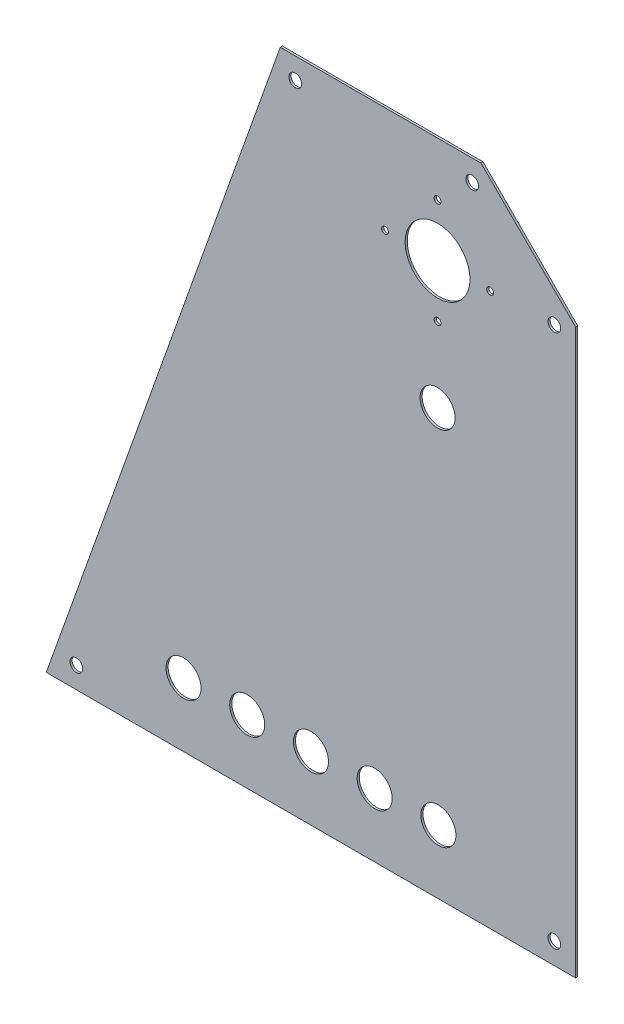
from build123d import *

# Parameters (mm, degrees)
SKETCH1_W           = 310
SKETCH1_H           = 250
BOSS_EXTRUDE1_DEPTH = 1
SKETCH2_OUTSIDE_W   = 391.65
SKETCH2_OUTSIDE_H   = 331.65
CUT_EXTRUDE1_DEPTH  = 200.125588511
SKETCH3_R           = 15.25
SKETCH3_R_2         = 8.25
SKETCH3_R_3         = 1.6
CUT_EXTRUDE2_DEPTH  = 200.125588511
SKETCH4_R           = 8.25
CUT_EXTRUDE3_DEPTH  = 200.125588511
SKETCH5_R           = 3
CUT_EXTRUDE4_DEPTH  = 200.125588511


with BuildPart() as part:
    # Sketch1 → Boss-Extrude1 (new body)
    with BuildSketch(Plane(origin=(0, 0, 0), x_dir=(0, 1, 0), z_dir=(0, 0, 1))):
        Rectangle(SKETCH1_W, SKETCH1_H)
    extrude(amount=BOSS_EXTRUDE1_DEPTH)

    # Sketch2 outside → Cut-Extrude1 (cut, through all)
    with BuildSketch(Plane(origin=(0, 0, 1), x_dir=(0, -1, 0), z_dir=(0, 0, 1))):
        Rectangle(SKETCH2_OUTSIDE_W, SKETCH2_OUTSIDE_H)
        Polygon((-155, -14.047727215), (155, -124.233933248), (155, 125), (-110.452272785, 125), (-155, 80.452272785), align=None, mode=Mode.SUBTRACT)
    extrude(amount=-CUT_EXTRUDE1_DEPTH, mode=Mode.SUBTRACT)

    # Sketch3 → Cut-Extrude2 (cut, through all)
    with BuildSketch(Plane(origin=(0, 0, 1), x_dir=(0, -1, 0), z_dir=(0, 0, 1))):
        with Locations((-105, 60)):
            Circle(SKETCH3_R)
        with Locations((-45, 60)):
            Circle(SKETCH3_R_2)
        with Locations((-105, 35.251262658)):
            Circle(SKETCH3_R_3)
        with Locations((-129.748737342, 60)):
            Circle(SKETCH3_R_3)
        with Locations((-105, 84.748737342)):
            Circle(SKETCH3_R_3)
        with Locations((-80.251262658, 60)):
            Circle(SKETCH3_R_3)
    extrude(amount=-CUT_EXTRUDE2_DEPTH, mode=Mode.SUBTRACT)

    # Sketch4 → Cut-Extrude3 (cut, through all)
    with BuildSketch(Plane(origin=(0, 0, 1), x_dir=(0, -1, 0), z_dir=(0, 0, 1))):
        with Locations((125, -59.616966624)):
            Circle(SKETCH4_R)
        with Locations((125, -29.616966624)):
            Circle(SKETCH4_R)
        with Locations((125, 0.383033376)):
            Circle(SKETCH4_R)
        with Locations((125, 30.383033376)):
            Circle(SKETCH4_R)
        with Locations((125, 60.383033376)):
            Circle(SKETCH4_R)
    extrude(amount=-CUT_EXTRUDE3_DEPTH, mode=Mode.SUBTRACT)

    # Sketch5 → Cut-Extrude4 (cut, through all)
    with BuildSketch(Plane(origin=(0, 0, 1), x_dir=(0, -1, 0), z_dir=(0, 0, 1))):
        with Locations((145, -110.066636279)):
            Circle(SKETCH5_R)
        with Locations((-145, -6.989217732)):
            Circle(SKETCH5_R)
        with Locations((-145, 76.310137162)):
            Circle(SKETCH5_R)
        with Locations((145, 115)):
            Circle(SKETCH5_R)
        with Locations((-106.310137162, 115)):
            Circle(SKETCH5_R)
    extrude(amount=-CUT_EXTRUDE4_DEPTH, mode=Mode.SUBTRACT)


solid = part.part
